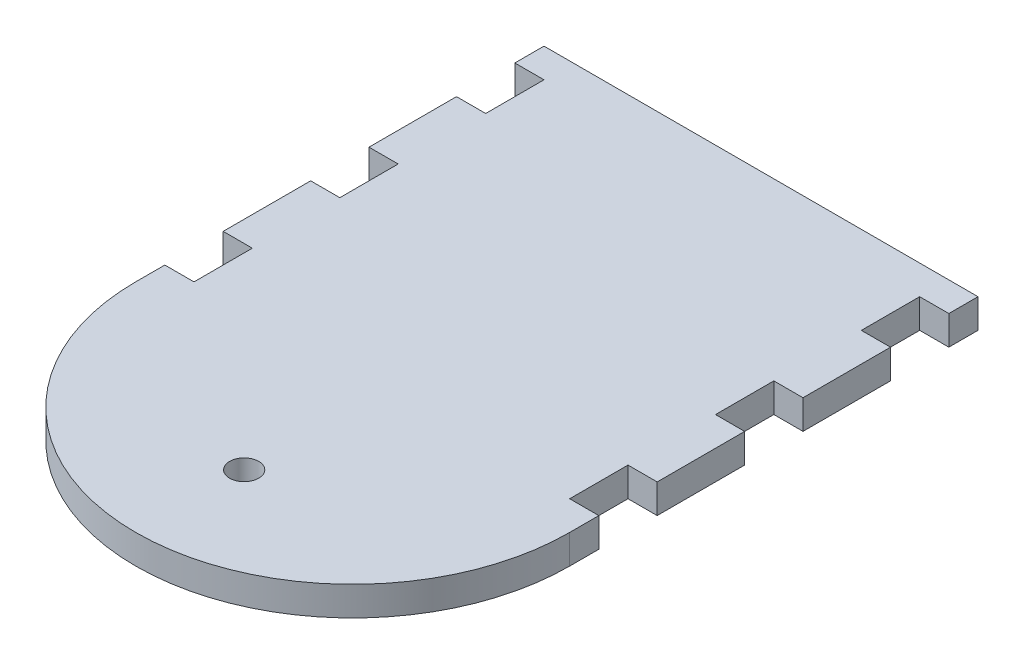
from build123d import *

# Parameters (mm, degrees)
SKETCH1_R           = 3.175
BOSS_EXTRUDE1_DEPTH = 6.35


with BuildPart() as part:
    # Sketch1 → Boss-Extrude1 (new body)
    with BuildSketch(Plane(origin=(0, 0, 0), x_dir=(1, 0, 0), z_dir=(0, 1, 0))):
        with BuildLine():
            Line((-47.244, 44.45), (47.244, 44.45))
            Line((47.244, 44.45), (47.244, 38.1))
            Line((47.244, 38.1), (40.894, 38.1))
            Line((40.894, 38.1), (40.894, 25.4))
            Line((40.894, 25.4), (47.244, 25.4))
            Line((47.244, 25.4), (47.244, 6.35))
            Line((47.244, 6.35), (40.894, 6.35))
            Line((40.894, 6.35), (40.894, -6.35))
            Line((40.894, -6.35), (47.244, -6.35))
            Line((47.244, -6.35), (47.244, -25.4))
            Line((47.244, -25.4), (40.894, -25.4))
            Line((40.894, -25.4), (40.894, -38.1))
            Line((40.894, -38.1), (47.244, -38.1))
            Line((47.244, -38.1), (47.244, -44.45))
            ThreePointArc((47.244, -44.45), (0, -91.694), (-47.244, -44.45))
            Line((-47.244, -44.45), (-47.244, -38.1))
            Line((-47.244, -38.1), (-40.894, -38.1))
            Line((-40.894, -38.1), (-40.894, -25.4))
            Line((-40.894, -25.4), (-47.244, -25.4))
            Line((-47.244, -25.4), (-47.244, -6.35))
            Line((-47.244, -6.35), (-40.894, -6.35))
            Line((-40.894, -6.35), (-40.894, 6.35))
            Line((-40.894, 6.35), (-47.244, 6.35))
            Line((-47.244, 6.35), (-47.244, 25.4))
            Line((-47.244, 25.4), (-40.894, 25.4))
            Line((-40.894, 25.4), (-40.894, 38.1))
            Line((-40.894, 38.1), (-47.244, 38.1))
            Line((-47.244, 38.1), (-47.244, 44.45))
        make_face()
        with Locations((0, -68.072)):
            Circle(SKETCH1_R, mode=Mode.SUBTRACT)
    extrude(amount=BOSS_EXTRUDE1_DEPTH)


solid = part.part
